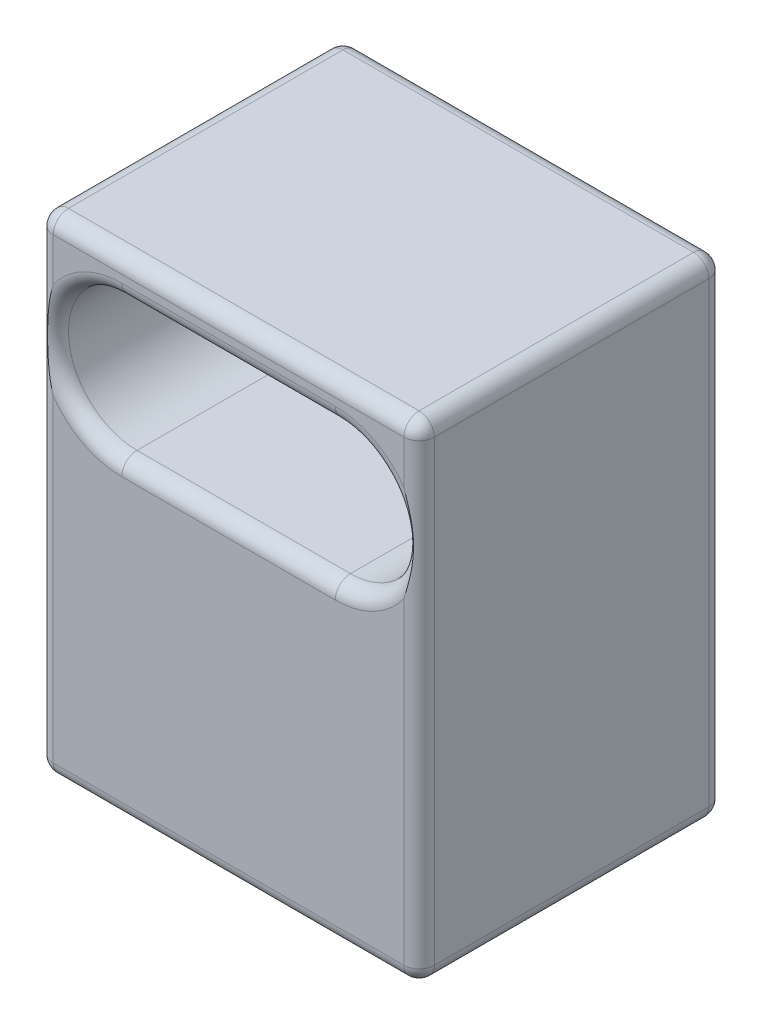
from build123d import *

# Parameters (mm, degrees)
CROQUIS1_W              = 25
CROQUIS1_H              = 32
SALIENTE_EXTRUIR1_DEPTH = 20
CORTAR_EXTRUIR2_DEPTH   = 20
CORTAR_EXTRUIR3_DEPTH   = 10
CROQUIS9_R              = 2.5
CORTAR_EXTRUIR4_DEPTH   = 10
CROQUIS10_W             = 8
CROQUIS10_H             = 4
CORTAR_EXTRUIR5_DEPTH   = 17
REDONDEO1_R             = 1


with BuildPart() as part:
    # Croquis1 → Saliente-Extruir1 (new body)
    with BuildSketch(Plane.XY):
        Rectangle(CROQUIS1_W, CROQUIS1_H)
    extrude(amount=SALIENTE_EXTRUIR1_DEPTH)

    # Croquis7 → Cortar-Extruir2 (cut)
    with BuildSketch(Plane.XY.offset(20)):
        with BuildLine():
            Line((-5, 11.75), (5, 11.75))
            ThreePointArc((5, 11.75), (7.75, 9), (5, 6.25))
            Line((5, 6.25), (-5, 6.25))
            ThreePointArc((-5, 6.25), (-7.75, 9), (-5, 11.75))
        make_face()
    extrude(amount=-CORTAR_EXTRUIR2_DEPTH, mode=Mode.SUBTRACT)

    # Croquis8 → Cortar-Extruir3 (cut)
    with BuildSketch(Plane.XY.offset(20)):
        with BuildLine():
            Line((-7, 13.5), (7, 13.5))
            ThreePointArc((7, 13.5), (11.5, 9), (7, 4.5))
            Line((7, 4.5), (-7, 4.5))
            ThreePointArc((-7, 4.5), (-11.5, 9), (-7, 13.5))
        make_face()
    extrude(amount=-CORTAR_EXTRUIR3_DEPTH, mode=Mode.SUBTRACT)

    # Croquis9 → Cortar-Extruir4 (cut)
    with BuildSketch(Plane.XZ.offset(16)):
        with Locations(Location((0, 12.5, 0), (0, 0, 270))):
            Circle(CROQUIS9_R)
    extrude(amount=-CORTAR_EXTRUIR4_DEPTH, mode=Mode.SUBTRACT)

    # Croquis10 → Cortar-Extruir5 (cut)
    with BuildSketch(Plane(origin=(0, 0, 0), x_dir=(-1, 0, 0), z_dir=(0, 0, -1))):
        with Locations((0, -9)):
            Rectangle(CROQUIS10_W, CROQUIS10_H)
    extrude(amount=-CORTAR_EXTRUIR5_DEPTH, mode=Mode.SUBTRACT)

    # Redondeo1
    # the kernel refuses this fillet: 1 mm, written as the material it takes off along each edge
    with BuildSketch(Plane(origin=(11.5, -15, 19), x_dir=(0, 0, 1), z_dir=(1, 0, 0))) as redondeo1_piece_1_section:
        Polygon((0, 0), (REDONDEO1_R, 0), (REDONDEO1_R, REDONDEO1_R), (0, REDONDEO1_R), align=None)
    redondeo1_piece_1 = extrude(amount=REDONDEO1_R, mode=Mode.PRIVATE)
    redondeo1_piece_1 = redondeo1_piece_1 - Plane(origin=(11.5, -15, 19), x_dir=(0, 0.7071067811865475, -0.7071067811865475), z_dir=(1, 0, 0)) * Sphere(REDONDEO1_R, mode=Mode.PRIVATE)
    add(redondeo1_piece_1, mode=Mode.SUBTRACT)
    with BuildSketch(Plane(origin=(11.5, 15, 19), x_dir=(1, 0, 0), z_dir=(0, 1, 0))) as redondeo1_piece_2_section:
        Polygon((0, 0), (REDONDEO1_R, 0), (REDONDEO1_R, -REDONDEO1_R), (0, -REDONDEO1_R), align=None)
    redondeo1_piece_2 = extrude(amount=REDONDEO1_R, mode=Mode.PRIVATE)
    redondeo1_piece_2 = redondeo1_piece_2 - Plane(origin=(11.5, 15, 19), x_dir=(-0.7071067811865475, 0, -0.7071067811865475), z_dir=(0, 1, 0)) * Sphere(REDONDEO1_R, mode=Mode.PRIVATE)
    add(redondeo1_piece_2, mode=Mode.SUBTRACT)
    with BuildSketch(Plane(origin=(-11.5, 15, 19), x_dir=(-1, 0, 0), z_dir=(0, 1, 0))) as redondeo1_piece_3_section:
        Polygon((0, 0), (REDONDEO1_R, 0), (REDONDEO1_R, REDONDEO1_R), (0, REDONDEO1_R), align=None)
    redondeo1_piece_3 = extrude(amount=REDONDEO1_R, mode=Mode.PRIVATE)
    redondeo1_piece_3 = redondeo1_piece_3 - Plane(origin=(-11.5, 15, 19), x_dir=(0.7071067811865475, 0, -0.7071067811865475), z_dir=(0, 1, 0)) * Sphere(REDONDEO1_R, mode=Mode.PRIVATE)
    add(redondeo1_piece_3, mode=Mode.SUBTRACT)
    with BuildSketch(Plane(origin=(-11.5, -15, 19), x_dir=(0, 0, 1), z_dir=(-1, 0, 0))) as redondeo1_piece_4_section:
        Polygon((0, 0), (REDONDEO1_R, 0), (REDONDEO1_R, -REDONDEO1_R), (0, -REDONDEO1_R), align=None)
    redondeo1_piece_4 = extrude(amount=REDONDEO1_R, mode=Mode.PRIVATE)
    redondeo1_piece_4 = redondeo1_piece_4 - Plane(origin=(-11.5, -15, 19), x_dir=(0, 0.7071067811865475, -0.7071067811865475), z_dir=(-1, 0, 0)) * Sphere(REDONDEO1_R, mode=Mode.PRIVATE)
    add(redondeo1_piece_4, mode=Mode.SUBTRACT)
    with BuildSketch(Plane(origin=(11.5, 15, 1), x_dir=(1, 0, 0), z_dir=(0, 1, 0))) as redondeo1_piece_5_section:
        Polygon((0, 0), (REDONDEO1_R, 0), (REDONDEO1_R, REDONDEO1_R), (0, REDONDEO1_R), align=None)
    redondeo1_piece_5 = extrude(amount=REDONDEO1_R, mode=Mode.PRIVATE)
    redondeo1_piece_5 = redondeo1_piece_5 - Plane(origin=(11.5, 15, 1), x_dir=(-0.7071067811865475, 0, 0.7071067811865475), z_dir=(0, 1, 0)) * Sphere(REDONDEO1_R, mode=Mode.PRIVATE)
    add(redondeo1_piece_5, mode=Mode.SUBTRACT)
    with BuildSketch(Plane(origin=(-11.5, 15, 1), x_dir=(-1, 0, 0), z_dir=(0, 1, 0))) as redondeo1_piece_6_section:
        Polygon((0, 0), (REDONDEO1_R, 0), (REDONDEO1_R, -REDONDEO1_R), (0, -REDONDEO1_R), align=None)
    redondeo1_piece_6 = extrude(amount=REDONDEO1_R, mode=Mode.PRIVATE)
    redondeo1_piece_6 = redondeo1_piece_6 - Plane(origin=(-11.5, 15, 1), x_dir=(0.7071067811865475, 0, 0.7071067811865475), z_dir=(0, 1, 0)) * Sphere(REDONDEO1_R, mode=Mode.PRIVATE)
    add(redondeo1_piece_6, mode=Mode.SUBTRACT)
    with BuildSketch(Plane(origin=(11.5, -15, 1), x_dir=(0, 0, -1), z_dir=(1, 0, 0))) as redondeo1_piece_7_section:
        Polygon((0, 0), (REDONDEO1_R, 0), (REDONDEO1_R, -REDONDEO1_R), (0, -REDONDEO1_R), align=None)
    redondeo1_piece_7 = extrude(amount=REDONDEO1_R, mode=Mode.PRIVATE)
    redondeo1_piece_7 = redondeo1_piece_7 - Plane(origin=(11.5, -15, 1), x_dir=(0, 0.7071067811865475, 0.7071067811865475), z_dir=(1, 0, 0)) * Sphere(REDONDEO1_R, mode=Mode.PRIVATE)
    add(redondeo1_piece_7, mode=Mode.SUBTRACT)
    with BuildSketch(Plane(origin=(-11.5, -15, 1), x_dir=(0, 0, -1), z_dir=(-1, 0, 0))) as redondeo1_piece_8_section:
        Polygon((0, 0), (REDONDEO1_R, 0), (REDONDEO1_R, REDONDEO1_R), (0, REDONDEO1_R), align=None)
    redondeo1_piece_8 = extrude(amount=REDONDEO1_R, mode=Mode.PRIVATE)
    redondeo1_piece_8 = redondeo1_piece_8 - Plane(origin=(-11.5, -15, 1), x_dir=(0, 0.7071067811865475, 0.7071067811865475), z_dir=(-1, 0, 0)) * Sphere(REDONDEO1_R, mode=Mode.PRIVATE)
    add(redondeo1_piece_8, mode=Mode.SUBTRACT)
    with BuildSketch(Plane(origin=(12.5, -15, 20), x_dir=(0, 0, -1), z_dir=(0, 1, 0)), Plane(origin=(-12.5, 15, 20), x_dir=(0, 0, -1), z_dir=(0, -1, 0))) as redondeo1_piece_9:
        with BuildLine():
            CenterArc((REDONDEO1_R, REDONDEO1_R), REDONDEO1_R, 180, 90)
            Line((0, REDONDEO1_R), (0, 0))
            Line((0, 0), (REDONDEO1_R, 0))
        make_face()
    extrude(amount=30, mode=Mode.SUBTRACT)
    with BuildSketch(Plane(origin=(11.5, 16, 20), x_dir=(0, 0, -1), z_dir=(-1, 0, 0)), Plane(origin=(-11.5, -16, 0), x_dir=(0, 1, 0), z_dir=(1, 0, 0))) as redondeo1_piece_10:
        with BuildLine():
            CenterArc((REDONDEO1_R, REDONDEO1_R), REDONDEO1_R, 180, 90)
            Line((0, REDONDEO1_R), (0, 0))
            Line((0, 0), (REDONDEO1_R, 0))
        make_face()
    extrude(amount=23, mode=Mode.SUBTRACT)
    with BuildSketch(Plane(origin=(5, 6.25, 10), x_dir=(0, 0, -1), z_dir=(-1, 0, 0)), Plane(origin=(-5, 11.75, 10), x_dir=(0, 0, -1), z_dir=(1, 0, 0))) as redondeo1_piece_11:
        with BuildLine():
            CenterArc((REDONDEO1_R, REDONDEO1_R), REDONDEO1_R, 180, 90)
            Line((0, REDONDEO1_R), (0, 0))
            Line((0, 0), (REDONDEO1_R, 0))
        make_face()
    extrude(amount=10, mode=Mode.SUBTRACT)
    with BuildSketch(Plane(origin=(-7, 9, 20), x_dir=(0, -1, 0), z_dir=(1, 0, 0))) as redondeo1_piece_12:
        with BuildLine():
            CenterArc((4.5 + REDONDEO1_R, REDONDEO1_R), REDONDEO1_R, 180, 90)
            Line((4.5, REDONDEO1_R), (4.5, 0))
            Line((4.5, 0), (4.5 + REDONDEO1_R, 0))
        make_face()
    revolve(axis=Axis((-7, 9, 20), (0, 0, -1)), revolution_arc=180, mode=Mode.SUBTRACT)
    with BuildSketch(Plane(origin=(7, 4.5, 20), x_dir=(0, -1, 0), z_dir=(-1, 0, 0)), Plane(origin=(-7, 13.5, 20), x_dir=(0, 1, 0), z_dir=(1, 0, 0))) as redondeo1_piece_13:
        with BuildLine():
            CenterArc((REDONDEO1_R, -REDONDEO1_R), REDONDEO1_R, 90, 90)
            Line((0, -REDONDEO1_R), (0, 0))
            Line((0, 0), (REDONDEO1_R, 0))
        make_face()
    extrude(amount=14, mode=Mode.SUBTRACT)
    with BuildSketch(Plane(origin=(7, 9, 20), x_dir=(0, 1, 0), z_dir=(-1, 0, 0))) as redondeo1_piece_14:
        with BuildLine():
            CenterArc((4.5 + REDONDEO1_R, REDONDEO1_R), REDONDEO1_R, 180, 90)
            Line((4.5, REDONDEO1_R), (4.5, 0))
            Line((4.5, 0), (4.5 + REDONDEO1_R, 0))
        make_face()
    revolve(axis=Axis((7, 9, 20), (0, 0, -1)), revolution_arc=180, mode=Mode.SUBTRACT)
    with BuildSketch(Plane(origin=(-5, 9, 10), x_dir=(0, 1, 0), z_dir=(1, 0, 0))) as redondeo1_piece_15:
        with BuildLine():
            CenterArc((2.75 + REDONDEO1_R, -REDONDEO1_R), REDONDEO1_R, 90, 90)
            Line((2.75 + REDONDEO1_R, 0), (2.75, 0))
            Line((2.75, 0), (2.75, -REDONDEO1_R))
        make_face()
    revolve(axis=Axis((-5, 9, 10), (0, 0, 1)), revolution_arc=180, mode=Mode.SUBTRACT)
    with BuildSketch(Plane(origin=(5, 9, 10), x_dir=(0, -1, 0), z_dir=(-1, 0, 0))) as redondeo1_piece_16:
        with BuildLine():
            CenterArc((2.75 + REDONDEO1_R, -REDONDEO1_R), REDONDEO1_R, 90, 90)
            Line((2.75 + REDONDEO1_R, 0), (2.75, 0))
            Line((2.75, 0), (2.75, -REDONDEO1_R))
        make_face()
    revolve(axis=Axis((5, 9, 10), (0, 0, 1)), revolution_arc=180, mode=Mode.SUBTRACT)
    with BuildSketch(Plane(origin=(11.5, 16, 0), x_dir=(0, 0, 1), z_dir=(-1, 0, 0)), Plane(origin=(-11.5, -16, 20), x_dir=(0, 1, 0), z_dir=(1, 0, 0))) as redondeo1_piece_17:
        with BuildLine():
            CenterArc((REDONDEO1_R, -REDONDEO1_R), REDONDEO1_R, 90, 90)
            Line((0, -REDONDEO1_R), (0, 0))
            Line((0, 0), (REDONDEO1_R, 0))
        make_face()
    extrude(amount=23, mode=Mode.SUBTRACT)
    with BuildSketch(Plane(origin=(0, -16, 12.5), x_dir=(0, 0, -1), z_dir=(-1, 0, 0))) as redondeo1_piece_18:
        with BuildLine():
            CenterArc((2.5 + REDONDEO1_R, -REDONDEO1_R), REDONDEO1_R, 90, 90)
            Line((2.5, -REDONDEO1_R), (2.5, 0))
            Line((2.5, 0), (2.5 + REDONDEO1_R, 0))
        make_face()
    revolve(axis=Axis((0, -16, 12.5), (0, -1, 0)), mode=Mode.SUBTRACT)
    with BuildSketch(Plane(origin=(12.5, -15, 0), x_dir=(0, 0, 1), z_dir=(0, 1, 0)), Plane(origin=(-12.5, 15, 0), x_dir=(0, 0, 1), z_dir=(0, -1, 0))) as redondeo1_piece_19:
        with BuildLine():
            CenterArc((REDONDEO1_R, -REDONDEO1_R), REDONDEO1_R, 90, 90)
            Line((0, -REDONDEO1_R), (0, 0))
            Line((0, 0), (REDONDEO1_R, 0))
        make_face()
    extrude(amount=30, mode=Mode.SUBTRACT)
    with BuildSketch(Plane(origin=(-12.5, 16, 1), x_dir=(1, 0, 0), z_dir=(0, 0, 1)), Plane(origin=(-12.5, -16, 1), x_dir=(0, 1, 0), z_dir=(0, 0, 1))) as redondeo1_piece_20:
        with BuildLine():
            CenterArc((REDONDEO1_R, -REDONDEO1_R), REDONDEO1_R, 90, 90)
            Line((0, -REDONDEO1_R), (0, 0))
            Line((0, 0), (REDONDEO1_R, 0))
        make_face()
    extrude(amount=18, mode=Mode.SUBTRACT)
    with BuildSketch(Plane(origin=(12.5, 16, 1), x_dir=(-1, 0, 0), z_dir=(0, 0, 1)), Plane(origin=(12.5, -16, 1), x_dir=(0, 1, 0), z_dir=(0, 0, 1))) as redondeo1_piece_21:
        with BuildLine():
            CenterArc((REDONDEO1_R, REDONDEO1_R), REDONDEO1_R, 180, 90)
            Line((0, REDONDEO1_R), (0, 0))
            Line((0, 0), (REDONDEO1_R, 0))
        make_face()
    extrude(amount=18, mode=Mode.SUBTRACT)


solid = part.part
